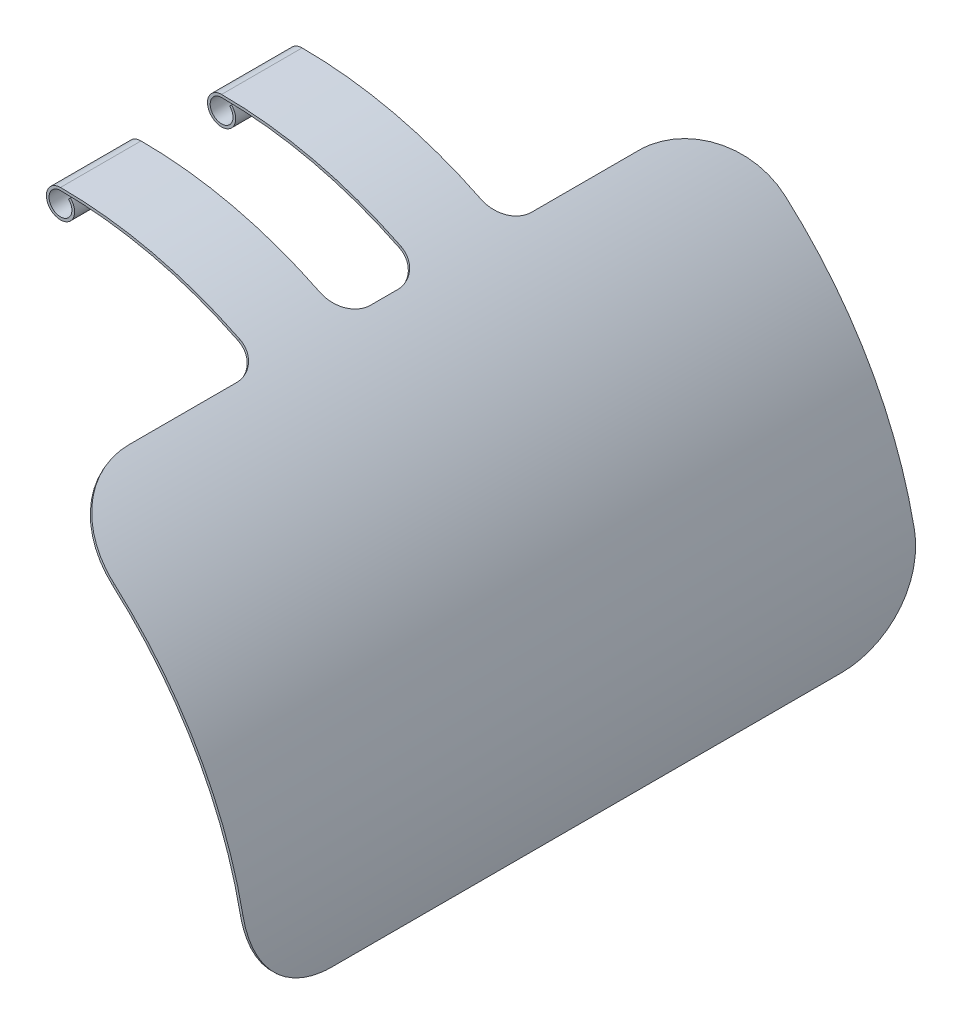
from build123d import *

# Parameters (mm, degrees)
BOSS_EXTRUDE1_DEPTH = 125
CUT_EXTRUDE1_DEPTH  = 15
CUT_EXTRUDE2_DEPTH  = 80
FILLET1_START       = 83.934299194
FILLET1_DEPTH       = 68.065700806
FILLET1_START_2     = 78.711006452
FILLET1_2_DEPTH     = 73.288993548
FILLET2_R           = 10


with BuildPart() as part:
    # Sketch2 → Boss-Extrude1 (new, symmetric)
    with BuildSketch(Plane.XY):
        with BuildLine():
            Line((3.00520382, 148.75520382), (3.712310601, 149.462310601))
            ThreePointArc((3.712310601, 149.462310601), (-2.00908802, 140.899632454), (0, 151))
            ThreePointArc((0, 151), (106.773123959, 106.773123959), (151, 0))
            Line((151, 0), (150, 0))
            ThreePointArc((150, 0), (106.066017178, 106.066017178), (0, 150))
            ThreePointArc((0, 150), (-1.626404588, 141.823511987), (3.00520382, 148.75520382))
        make_face()
    extrude(amount=BOSS_EXTRUDE1_DEPTH, both=True)

    # Sketch3 → Cut-Extrude1 (cut, symmetric)
    with BuildSketch(Plane.XY):
        with BuildLine():
            Line((75, 129.903810568), (75.5, 130.769835971))
            ThreePointArc((75.5, 130.769835971), (39.08167581, 145.85479977), (0, 151))
            ThreePointArc((0, 151), (-2.00908802, 140.899632454), (3.712310601, 149.462310601))
            Line((3.712310601, 149.462310601), (3.00520382, 148.75520382))
            ThreePointArc((3.00520382, 148.75520382), (-1.626404588, 141.823511987), (0, 150))
            ThreePointArc((0, 150), (38.822856765, 144.888873943), (75, 129.903810568))
        make_face()
    extrude(amount=CUT_EXTRUDE1_DEPTH, both=True, mode=Mode.SUBTRACT)

    # Sketch4 → Cut-Extrude2 (cut)
    with BuildSketch(Plane.XY.offset(125)):
        with BuildLine():
            Line((75, 129.903810568), (75.5, 130.769835971))
            ThreePointArc((75.5, 130.769835971), (39.08167581, 145.85479977), (0, 151))
            ThreePointArc((0, 151), (-2.00908802, 140.899632454), (3.712310601, 149.462310601))
            Line((3.712310601, 149.462310601), (3.00520382, 148.75520382))
            ThreePointArc((3.00520382, 148.75520382), (-1.626404588, 141.823511987), (0, 150))
            ThreePointArc((0, 150), (38.822856765, 144.888873943), (75, 129.903810568))
        make_face()
    cut_extrude2 = extrude(amount=-CUT_EXTRUDE2_DEPTH, mode=Mode.SUBTRACT)

    # Mirror1: Cut-Extrude2 across plane
    add(cut_extrude2.mirror(Plane.XY), mode=Mode.SUBTRACT)

    # Fillet1: read off the stored shape, not the designer's step
    # Fillet1 outline → Fillet1 (cut)
    with BuildSketch(Plane(origin=(0, 0, 0), x_dir=(0.8660254037844386, -0.4999999999999999, 0), z_dir=(0.4999999999999999, 0.8660254037844388, 0)).offset(FILLET1_START)):
        with BuildLine():
            Line((0, 125), (0, 95))
            ThreePointArc((0, 95), (8.786796564, 116.213203436), (30, 125))
            Line((30, 125), (0, 125))
        make_face()
        with BuildLine():
            Line((0, -125), (30, -125))
            ThreePointArc((30, -125), (8.786796564, -116.213203436), (0, -95))
            Line((0, -95), (0, -125))
        make_face()
    extrude(amount=FILLET1_DEPTH, mode=Mode.SUBTRACT)

    # Fillet1 2 outline → Fillet1 2 (cut)
    with BuildSketch(Plane.YZ.offset(FILLET1_START_2)):
        with BuildLine():
            ThreePointArc((30, -125), (8.786796564, -116.213203436), (0, -95))
            Line((0, -95), (0, -125))
            Line((0, -125), (30, -125))
        make_face()
        with BuildLine():
            Line((0, 125), (0, 95))
            ThreePointArc((0, 95), (8.786796564, 116.213203436), (30, 125))
            Line((30, 125), (0, 125))
        make_face()
    extrude(amount=FILLET1_2_DEPTH, mode=Mode.SUBTRACT)

    # Fillet2
    fillet2_edges = [part.edges().sort_by_distance(p)[0] for p in [
        (75.25, 130.33682327, -15),
        (75.25, 130.33682327, 15),
        (75.25, 130.33682327, 45),
        (75.25, 130.33682327, -45),
    ]]
    fillet(fillet2_edges, radius=FILLET2_R)


solid = part.part
